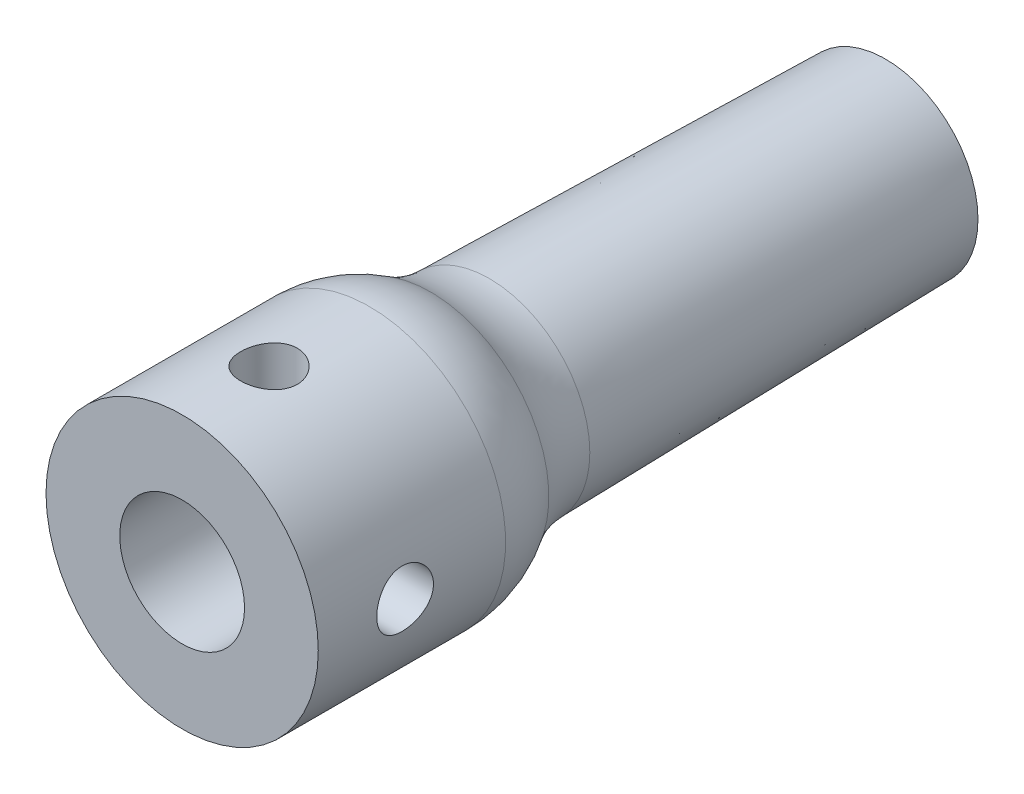
from build123d import *

# Parameters (mm, degrees)
SKETCH1_R               = 4.5
SKETCH1_R_2             = 2.75
BOSS_EXTRUDE1_DEPTH     = 21
DRAFT1_ANGLE            = -1.16
SKETCH2_R               = 6
SKETCH2_R_2             = 2.75
BOSS_EXTRUDE2_DEPTH     = 10
FILLET2_R               = 5
CUT_EXTRUDE1_REACH      = 35.779
CUT_EXTRUDE1_END_RADIUS = 2.75
SKETCH4_R               = 1.25
CIRPATTERN1_COUNT       = 2
CIRPATTERN1_ANGLE       = 90


with BuildPart() as part:
    # Sketch1 → Boss-Extrude1 (new body)
    with BuildSketch(Plane.XY):
        with Locations(Location((0, 0, 0), (0, 0, 180))):
            Circle(SKETCH1_R)
        with Locations(Location((0, 0, 0), (0, 0, 180))):
            Circle(SKETCH1_R_2, mode=Mode.SUBTRACT)
    extrude(amount=BOSS_EXTRUDE1_DEPTH)

    # Draft1
    draft1_faces = [part.faces().sort_by_distance(p)[0] for p in [
        (4.5, 0, 10.5),
    ]]
    draft(draft1_faces, Plane.XY.offset(21), DRAFT1_ANGLE)

    # Sketch2 → Boss-Extrude2 (add)
    with BuildSketch(Plane.XY.offset(21)):
        Circle(SKETCH2_R)
        with Locations(Location((0, 0, 0), (0, 0, 180))):
            Circle(SKETCH2_R_2, mode=Mode.SUBTRACT)
    extrude(amount=BOSS_EXTRUDE2_DEPTH)

    # Fillet1: read off the stored shape, not the designer's step
    # Fillet1 outline → Fillet1 (revolve)
    with BuildSketch(Plane.XZ):
        with BuildLine():
            Line((6, 21), (4.42833376, 21))
            Line((4.42833376, 21), (4.42833376, 17.460679283))
            ThreePointArc((4.42833376, 17.460679283), (4.857597383, 19.388677437), (6, 21))
        make_face()
    revolve(axis=Axis((0, 0, 0), (0, 0, 1)))

    # Fillet2
    fillet2_edges = [part.edges().sort_by_distance(p)[0] for p in [
        (-6, 0, 21),
    ]]
    fillet(fillet2_edges, radius=FILLET2_R)

    # Cut-Extrude1: up to this cylinder (the profile starts outside it)
    cut_extrude1_end = Plane(origin=(0, 0, 27.172961), z_dir=(0, 0, -1)) * Cylinder(CUT_EXTRUDE1_END_RADIUS, 78.058, mode=Mode.PRIVATE)
    # Sketch4 → Cut-Extrude1 (cut, up to the surface)
    with BuildSketch(Plane(origin=(6, 0, 31), x_dir=(0, 0, -1), z_dir=(1, 0, 0)), mode=Mode.PRIVATE) as cut_extrude1_sk1:
        with Locations(Location((3.827038513, 0, 0), (0, 0, 90))):
            Circle(SKETCH4_R)
    cut_extrude1_tool1 = extrude(cut_extrude1_sk1.sketch, amount=-CUT_EXTRUDE1_REACH, mode=Mode.PRIVATE) - cut_extrude1_end
    cut_extrude1 = cut_extrude1_tool1.solids().sort_by_distance((6, 0, 27.172961))[0]
    add(cut_extrude1, mode=Mode.SUBTRACT)

    # CirPattern1: Cut-Extrude1 ×2 about axis
    cirpattern1_axis = Axis((0, 0, 0), (0, 0, 1))
    for i in range(1, CIRPATTERN1_COUNT):
        add(cut_extrude1.rotate(cirpattern1_axis, i * CIRPATTERN1_ANGLE / (CIRPATTERN1_COUNT - 1)), mode=Mode.SUBTRACT)


solid = part.part
